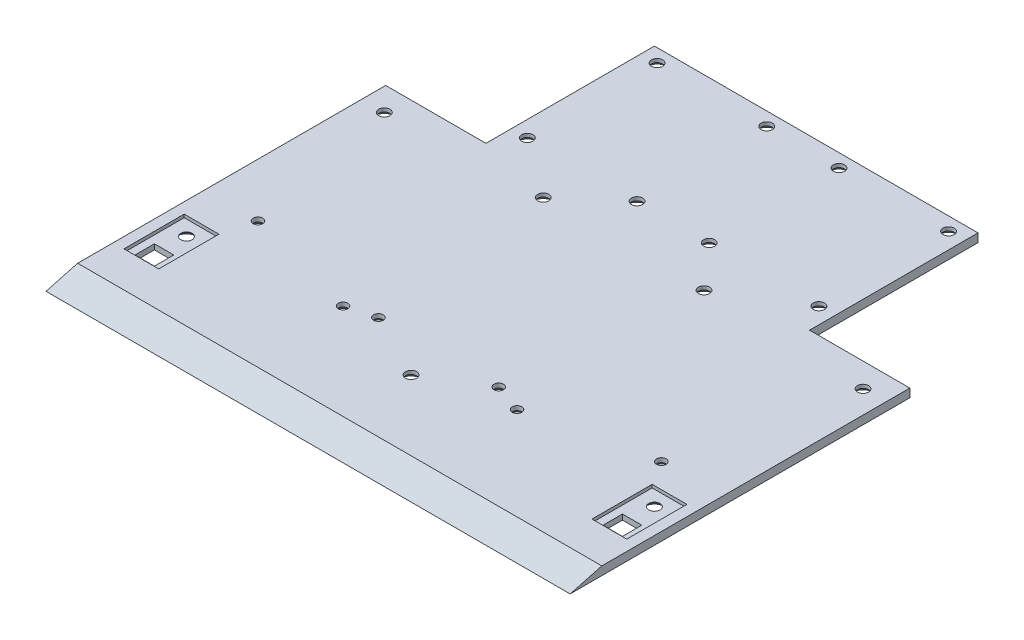
from build123d import *

# Parameters (mm, degrees)
SALIENTE_EXTRUIR1_DEPTH                              = 196
CORTAR_EXTRUIR1_REACH                                = 274.995
CROQUIS2_W                                           = 37.5
CROQUIS2_H                                           = 62.989872981
CROQUIS3_W                                           = 13
CROQUIS3_H                                           = 22.5
CORTAR_EXTRUIR2_DEPTH                                = 1.17
CORTAR_EXTRUIR3_REACH                                = 274.984
CROQUIS5_W                                           = 7.25
CROQUIS5_H                                           = 7.25
CORTAR_EXTRUIR4_REACH                                = 274.984
CROQUIS6_R                                           = 1.6
CUT_EXTRUDE1_REACH                                   = 274.995
SKETCH1_R                                            = 1.585
CUT_EXTRUDE2_REACH                                   = 274.995
SKETCH2_R                                            = 1.585
CUT_EXTRUDE3_REACH                                   = 274.995
SKETCH3_R                                            = 1.579889923
SKETCH3_R_2                                          = 1.585
SKETCH4_R                                            = 1.6
CUT_EXTRUDE4_DEPTH                                   = 4.9
AVELLANADO_PARA_TORNILLO_CON_CABEZA_AVEL_D           = 4.2
AVELLANADO_PARA_TORNILLO_CON_CABEZA_AVEL_DEPTH       = 10
AVELLANADO_PARA_TORNILLO_CON_CABEZA_AVEL_CSINK_D     = 8
AVELLANADO_PARA_TORNILLO_CON_CABEZA_AVEL_CSINK_ANGLE = 92
AVELLANADO_PARA_TORNILLO_CON_CABEZA_AVEL_TIP         = 1.2618073
SKETCH12_R                                           = 1.575419973
CUT_EXTRUDE6_DEPTH                                   = 10
REFRENTADO_PARA_TORNILLO_TAP_N_CON_CABEZ_D           = 3.6
REFRENTADO_PARA_TORNILLO_TAP_N_CON_CABEZ_DEPTH       = 10
REFRENTADO_PARA_TORNILLO_TAP_N_CON_CABEZ_CSINK_D     = 6.72
REFRENTADO_PARA_TORNILLO_TAP_N_CON_CABEZ_CSINK_ANGLE = 90
REFRENTADO_PARA_TORNILLO_TAP_N_CON_CABEZ_TIP         = 1.081549114


with BuildPart() as part:
    # Croquis1 → Saliente-Extruir1 (new body)
    with BuildSketch(Plane(origin=(0, 0, 0), x_dir=(0, 0, -1), z_dir=(1, 0, 0))):
        Polygon((0, 0), (190, 0), (190, 3.17), (11.83060106, 3.17), align=None)
    extrude(amount=SALIENTE_EXTRUIR1_DEPTH)

    # Croquis2 → Cortar-Extruir1 (cut, up to next)
    with BuildSketch(Plane(origin=(0, 0, 0), x_dir=(-1, 0, 0), z_dir=(0, -1, 0)), mode=Mode.PRIVATE) as cortar_extruir1_sk1:
        with Locations((-18.75, 158.50506351)):
            Rectangle(CROQUIS2_W, CROQUIS2_H)
    cortar_extruir1_tool1 = extrude(cortar_extruir1_sk1.sketch, amount=-CORTAR_EXTRUIR1_REACH, mode=Mode.PRIVATE) & part.part
    cortar_extruir1 = cortar_extruir1_tool1.solids().sort_by_distance((18.75, 0, -158.505064))[0]
    add(cortar_extruir1, mode=Mode.SUBTRACT)

    # Simetría1: Cortar-Extruir1 across plane
    add(cortar_extruir1.mirror(Plane.ZY.offset(-98)), mode=Mode.SUBTRACT)

    # Croquis3 → Cortar-Extruir2 (cut)
    with BuildSketch(Plane(origin=(0, 3.17, 0), x_dir=(1, 0, 0), z_dir=(0, 1, 0))):
        with Locations((10.5, 36.41)):
            Rectangle(CROQUIS3_W, CROQUIS3_H)
    cortar_extruir2 = extrude(amount=-CORTAR_EXTRUIR2_DEPTH, mode=Mode.SUBTRACT)

    # Croquis5 → Cortar-Extruir3 (cut, up to next)
    with BuildSketch(Plane(origin=(0, 2, 0), x_dir=(1, 0, 0), z_dir=(0, 1, 0)), mode=Mode.PRIVATE) as cortar_extruir3_sk1:
        with Locations((10.5, 30.035)):
            Rectangle(CROQUIS5_W, CROQUIS5_H)
    cortar_extruir3_tool1 = extrude(cortar_extruir3_sk1.sketch, amount=-CORTAR_EXTRUIR3_REACH, mode=Mode.PRIVATE) & part.part
    cortar_extruir3 = cortar_extruir3_tool1.solids().sort_by_distance((10.5, 2, -30.035))[0]
    add(cortar_extruir3, mode=Mode.SUBTRACT)

    # Croquis6 → Cortar-Extruir4 (cut, up to next)
    with BuildSketch(Plane(origin=(0, 2, 0), x_dir=(1, 0, 0), z_dir=(0, 1, 0)), mode=Mode.PRIVATE) as cortar_extruir4_sk1:
        with Locations((10.5, 42.01)):
            Circle(CROQUIS6_R)
    cortar_extruir4_tool1 = extrude(cortar_extruir4_sk1.sketch, amount=-CORTAR_EXTRUIR4_REACH, mode=Mode.PRIVATE) & part.part
    cortar_extruir4 = cortar_extruir4_tool1.solids().sort_by_distance((10.5, 2, -42.01))[0]
    add(cortar_extruir4, mode=Mode.SUBTRACT)

    # Simetría2: Cortar-Extruir2, Cortar-Extruir3, Cortar-Extruir4 across plane
    add(cortar_extruir2.mirror(Plane.ZY.offset(-98)), mode=Mode.SUBTRACT)
    add(cortar_extruir3.mirror(Plane.ZY.offset(-98)), mode=Mode.SUBTRACT)
    add(cortar_extruir4.mirror(Plane.ZY.offset(-98)), mode=Mode.SUBTRACT)

    # Sketch1 → Cut-Extrude1 (cut, up to next)
    with BuildSketch(Plane(origin=(0, 3.17, 0), x_dir=(1, 0, 0), z_dir=(0, 1, 0)), mode=Mode.PRIVATE) as cut_extrude1_sk1:
        with Locations((8.5, 118.010127019)):
            Circle(SKETCH1_R)
    cut_extrude1_tool1 = extrude(cut_extrude1_sk1.sketch, amount=-CUT_EXTRUDE1_REACH, mode=Mode.PRIVATE) & part.part
    # Sketch1 → Cut-Extrude1 (cut, up to next)
    with BuildSketch(Plane(origin=(0, 3.17, 0), x_dir=(1, 0, 0), z_dir=(0, 1, 0)), mode=Mode.PRIVATE) as cut_extrude1_sk2:
        with Locations((187.5, 118.010127019)):
            Circle(SKETCH1_R)
    cut_extrude1_tool2 = extrude(cut_extrude1_sk2.sketch, amount=-CUT_EXTRUDE1_REACH, mode=Mode.PRIVATE) & part.part
    add(cut_extrude1_tool1.solids().sort_by_distance((8.5, 3.17, -118.010127))[0], mode=Mode.SUBTRACT)
    add(cut_extrude1_tool2.solids().sort_by_distance((187.5, 3.17, -118.010127))[0], mode=Mode.SUBTRACT)

    # Sketch2 → Cut-Extrude2 (cut, up to next)
    with BuildSketch(Plane(origin=(0, 3.17, 0), x_dir=(1, 0, 0), z_dir=(0, 1, 0)), mode=Mode.PRIVATE) as cut_extrude2_sk1:
        with Locations((98.5, 38.010127019)):
            Circle(SKETCH2_R)
    cut_extrude2_tool1 = extrude(cut_extrude2_sk1.sketch, amount=-CUT_EXTRUDE2_REACH, mode=Mode.PRIVATE) & part.part
    add(cut_extrude2_tool1.solids().sort_by_distance((98.5, 3.17, -38.010127))[0], mode=Mode.SUBTRACT)

    # Sketch3 → Cut-Extrude3 (cut, up to next)
    with BuildSketch(Plane(origin=(0, 3.17, 0), x_dir=(1, 0, 0), z_dir=(0, 1, 0)), mode=Mode.PRIVATE) as cut_extrude3_sk1:
        with Locations((43.5, 185)):
            Circle(SKETCH3_R)
    cut_extrude3_tool1 = extrude(cut_extrude3_sk1.sketch, amount=-CUT_EXTRUDE3_REACH, mode=Mode.PRIVATE) & part.part
    # Sketch3 → Cut-Extrude3 (cut, up to next)
    with BuildSketch(Plane(origin=(0, 3.17, 0), x_dir=(1, 0, 0), z_dir=(0, 1, 0)), mode=Mode.PRIVATE) as cut_extrude3_sk2:
        with Locations((84.5, 185)):
            Circle(SKETCH3_R_2)
    cut_extrude3_tool2 = extrude(cut_extrude3_sk2.sketch, amount=-CUT_EXTRUDE3_REACH, mode=Mode.PRIVATE) & part.part
    # Sketch3 → Cut-Extrude3 (cut, up to next)
    with BuildSketch(Plane(origin=(0, 3.17, 0), x_dir=(1, 0, 0), z_dir=(0, 1, 0)), mode=Mode.PRIVATE) as cut_extrude3_sk3:
        with Locations((152.5, 185)):
            Circle(SKETCH3_R_2)
    cut_extrude3_tool3 = extrude(cut_extrude3_sk3.sketch, amount=-CUT_EXTRUDE3_REACH, mode=Mode.PRIVATE) & part.part
    # Sketch3 → Cut-Extrude3 (cut, up to next)
    with BuildSketch(Plane(origin=(0, 3.17, 0), x_dir=(1, 0, 0), z_dir=(0, 1, 0)), mode=Mode.PRIVATE) as cut_extrude3_sk4:
        with Locations((111.5, 185)):
            Circle(SKETCH3_R_2)
    cut_extrude3_tool4 = extrude(cut_extrude3_sk4.sketch, amount=-CUT_EXTRUDE3_REACH, mode=Mode.PRIVATE) & part.part
    # Sketch3 → Cut-Extrude3 (cut, up to next)
    with BuildSketch(Plane(origin=(0, 3.17, 0), x_dir=(1, 0, 0), z_dir=(0, 1, 0)), mode=Mode.PRIVATE) as cut_extrude3_sk5:
        with Locations((111.5, 136.5)):
            Circle(SKETCH3_R_2)
    cut_extrude3_tool5 = extrude(cut_extrude3_sk5.sketch, amount=-CUT_EXTRUDE3_REACH, mode=Mode.PRIVATE) & part.part
    # Sketch3 → Cut-Extrude3 (cut, up to next)
    with BuildSketch(Plane(origin=(0, 3.17, 0), x_dir=(1, 0, 0), z_dir=(0, 1, 0)), mode=Mode.PRIVATE) as cut_extrude3_sk6:
        with Locations((152.5, 136.5)):
            Circle(SKETCH3_R_2)
    cut_extrude3_tool6 = extrude(cut_extrude3_sk6.sketch, amount=-CUT_EXTRUDE3_REACH, mode=Mode.PRIVATE) & part.part
    # Sketch3 → Cut-Extrude3 (cut, up to next)
    with BuildSketch(Plane(origin=(0, 3.17, 0), x_dir=(1, 0, 0), z_dir=(0, 1, 0)), mode=Mode.PRIVATE) as cut_extrude3_sk7:
        with Locations((84.5, 136.5)):
            Circle(SKETCH3_R_2)
    cut_extrude3_tool7 = extrude(cut_extrude3_sk7.sketch, amount=-CUT_EXTRUDE3_REACH, mode=Mode.PRIVATE) & part.part
    # Sketch3 → Cut-Extrude3 (cut, up to next)
    with BuildSketch(Plane(origin=(0, 3.17, 0), x_dir=(1, 0, 0), z_dir=(0, 1, 0)), mode=Mode.PRIVATE) as cut_extrude3_sk8:
        with Locations((43.5, 136.5)):
            Circle(SKETCH3_R_2)
    cut_extrude3_tool8 = extrude(cut_extrude3_sk8.sketch, amount=-CUT_EXTRUDE3_REACH, mode=Mode.PRIVATE) & part.part
    add(cut_extrude3_tool1.solids().sort_by_distance((43.5, 3.17, -185))[0], mode=Mode.SUBTRACT)
    add(cut_extrude3_tool2.solids().sort_by_distance((84.5, 3.17, -185))[0], mode=Mode.SUBTRACT)
    add(cut_extrude3_tool3.solids().sort_by_distance((152.5, 3.17, -185))[0], mode=Mode.SUBTRACT)
    add(cut_extrude3_tool4.solids().sort_by_distance((111.5, 3.17, -185))[0], mode=Mode.SUBTRACT)
    add(cut_extrude3_tool5.solids().sort_by_distance((111.5, 3.17, -136.5))[0], mode=Mode.SUBTRACT)
    add(cut_extrude3_tool6.solids().sort_by_distance((152.5, 3.17, -136.5))[0], mode=Mode.SUBTRACT)
    add(cut_extrude3_tool7.solids().sort_by_distance((84.5, 3.17, -136.5))[0], mode=Mode.SUBTRACT)
    add(cut_extrude3_tool8.solids().sort_by_distance((43.5, 3.17, -136.5))[0], mode=Mode.SUBTRACT)

    # Sketch4 → Cut-Extrude4 (cut)
    with BuildSketch(Plane(origin=(0, 3.17, 0), x_dir=(1, 0, 0), z_dir=(0, 1, 0))):
        with Locations((65.776416732, 120.166862559)):
            Circle(SKETCH4_R)
        with Locations((125.876416732, 120.166862559)):
            Circle(SKETCH4_R)
    extrude(amount=-CUT_EXTRUDE4_DEPTH, mode=Mode.SUBTRACT)

    # Avellanado para tornillo con cabeza avellanada en cruz de M3.51
    with Locations(Plane(origin=(187.5, 0, -118.010127019), x_dir=(0, 0, -1), z_dir=(0, -1, 0))):
        with Locations((0, 0), (18.489872981, -35), (2.15673554, -61.623583268), (18.489872981, -76), (18.489872981, -103), (2.15673554, -121.723583268), (18.489872981, -144), (0, -179), (66.989872981, -144), (66.989872981, -103), (66.989872981, -76), (66.989872981, -35), (-76.000127019, -177), (-80, -89), (-76.000127019, -2)):
            CounterSinkHole(AVELLANADO_PARA_TORNILLO_CON_CABEZA_AVEL_D / 2, AVELLANADO_PARA_TORNILLO_CON_CABEZA_AVEL_CSINK_D / 2, depth=AVELLANADO_PARA_TORNILLO_CON_CABEZA_AVEL_DEPTH, counter_sink_angle=AVELLANADO_PARA_TORNILLO_CON_CABEZA_AVEL_CSINK_ANGLE)
            with Locations((0, 0, -(AVELLANADO_PARA_TORNILLO_CON_CABEZA_AVEL_DEPTH + AVELLANADO_PARA_TORNILLO_CON_CABEZA_AVEL_TIP / 2))):  # 118° drill point
                Cone(0, AVELLANADO_PARA_TORNILLO_CON_CABEZA_AVEL_D / 2, AVELLANADO_PARA_TORNILLO_CON_CABEZA_AVEL_TIP, mode=Mode.SUBTRACT)

    # Sketch12 → Cut-Extrude6 (cut)
    with BuildSketch(Plane(origin=(0, 3.17, 0), x_dir=(1, 0, 0), z_dir=(0, 1, 0))):
        with Locations((20.010826356, 59.24770363)):
            Circle(SKETCH12_R)
        with Locations((63.468062002, 47.603372434)):
            Circle(SKETCH12_R)
        with Locations((73.798412788, 50.491310094)):
            Circle(SKETCH12_R)
        with Locations((118.788653719, 50.491310094)):
            Circle(SKETCH12_R)
        with Locations((129.523650189, 46.609634544)):
            Circle(SKETCH12_R)
        with Locations((173.36079416, 56.730236676)):
            Circle(SKETCH12_R)
    extrude(amount=-CUT_EXTRUDE6_DEPTH, mode=Mode.SUBTRACT)

    # Refrentado para tornillo tapón con cabeza plana de clavija de M31
    with Locations(Plane(origin=(173.36079416, 0, -56.730236676), x_dir=(0, 0, -1), z_dir=(0, -1, 0))):
        with Locations((0, 0), (-10.120602132, -43.837143971), (-6.238926582, -54.572140441), (-9.126864242, -109.892732158), (-6.238926582, -99.562381372), (2.517466954, -153.349967804)):
            CounterSinkHole(REFRENTADO_PARA_TORNILLO_TAP_N_CON_CABEZ_D / 2, REFRENTADO_PARA_TORNILLO_TAP_N_CON_CABEZ_CSINK_D / 2, depth=REFRENTADO_PARA_TORNILLO_TAP_N_CON_CABEZ_DEPTH, counter_sink_angle=REFRENTADO_PARA_TORNILLO_TAP_N_CON_CABEZ_CSINK_ANGLE)
            with Locations((0, 0, -(REFRENTADO_PARA_TORNILLO_TAP_N_CON_CABEZ_DEPTH + REFRENTADO_PARA_TORNILLO_TAP_N_CON_CABEZ_TIP / 2))):  # 118° drill point
                Cone(0, REFRENTADO_PARA_TORNILLO_TAP_N_CON_CABEZ_D / 2, REFRENTADO_PARA_TORNILLO_TAP_N_CON_CABEZ_TIP, mode=Mode.SUBTRACT)


solid = part.part
